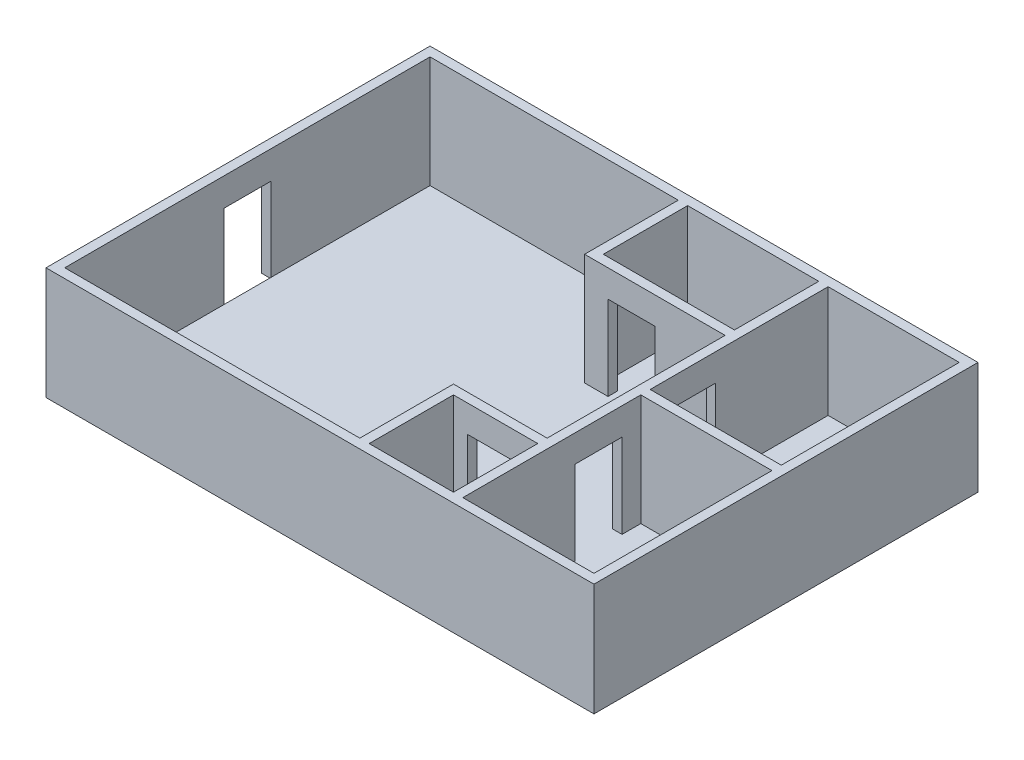
from build123d import *

# Parameters (mm, degrees)
EXTRUDE_THIN1_OUTLINE_W   = 1485.9
EXTRUDE_THIN1_OUTLINE_H   = 1041.4
EXTRUDE_THIN1_OUTLINE_W_2 = 228.6
EXTRUDE_THIN1_OUTLINE_H_2 = 228.6
EXTRUDE_THIN1_OUTLINE_W_3 = 355.6
EXTRUDE_THIN1_OUTLINE_H_3 = 482.6
EXTRUDE_THIN1_DEPTH       = 304.8
SKETCH1_5_W               = 1460.5
SKETCH1_5_H               = 1016
BOSS_EXTRUDE1_DEPTH       = 2.54
CUT_EXTRUDE1_DEPTH        = 25.4
SKETCH4_W                 = 127
SKETCH4_H                 = 228.6
CUT_EXTRUDE2_DEPTH        = 25.4
SKETCH5_W                 = 127
SKETCH5_H                 = 228.6
CUT_EXTRUDE3_DEPTH        = 25.4
SKETCH6_W                 = 127
SKETCH6_H                 = 228.6
CUT_EXTRUDE4_DEPTH        = 25.4


# Read off the part's stored shape, not the designer's step: Extrude-Thin1
with BuildPart() as part:
    # Extrude-Thin1 outline → Extrude-Thin1 (new body)
    with BuildSketch(Plane(origin=(0, 0, 0), x_dir=(1, 0, 0), z_dir=(0, 1, 0))):
        Rectangle(EXTRUDE_THIN1_OUTLINE_W, EXTRUDE_THIN1_OUTLINE_H)
        with Locations((222.25, -381)):
            Rectangle(EXTRUDE_THIN1_OUTLINE_W_2, EXTRUDE_THIN1_OUTLINE_H_2, mode=Mode.SUBTRACT)
        with Locations((539.75, -254)):
            Rectangle(EXTRUDE_THIN1_OUTLINE_W_3, EXTRUDE_THIN1_OUTLINE_H_3, mode=Mode.SUBTRACT)
        Polygon((-44.45, 495.3), (-44.45, 241.3), (336.55, 241.3), (336.55, -241.3), (82.55, -241.3), (82.55, -495.3), (-717.55, -495.3), (-717.55, 495.3), align=None, mode=Mode.SUBTRACT)
        with Locations((539.75, 254)):
            Rectangle(EXTRUDE_THIN1_OUTLINE_W_3, EXTRUDE_THIN1_OUTLINE_H_3, mode=Mode.SUBTRACT)
        with Locations((158.75, 381)):
            Rectangle(EXTRUDE_THIN1_OUTLINE_W_3, EXTRUDE_THIN1_OUTLINE_H_2, mode=Mode.SUBTRACT)
    extrude(amount=EXTRUDE_THIN1_DEPTH)

    # Sketch1<5> → Boss-Extrude1 (add)
    with BuildSketch(Plane(origin=(0, 0, 0), x_dir=(1, 0, 0), z_dir=(0, 1, 0))):
        Rectangle(SKETCH1_5_W, SKETCH1_5_H)
    extrude(amount=BOSS_EXTRUDE1_DEPTH)

    # Sketch2 → Cut-Extrude1 (cut)
    with BuildSketch(Plane.ZY.offset(742.95)):
        Polygon((-63.5, 0), (-63.5, 228.6), (63.5, 228.6), (63.5, 0), (0, 0), align=None)
    extrude(amount=-CUT_EXTRUDE1_DEPTH, mode=Mode.SUBTRACT)

    # Sketch4 → Cut-Extrude2 (cut)
    with BuildSketch(Plane.ZY.offset(-336.55)):
        with Locations((-127, 116.84)):
            Rectangle(SKETCH4_W, SKETCH4_H)
        with Locations((127, 116.84)):
            Rectangle(SKETCH4_W, SKETCH4_H)
    extrude(amount=-CUT_EXTRUDE2_DEPTH, mode=Mode.SUBTRACT)

    # Sketch5 → Cut-Extrude3 (cut)
    with BuildSketch(Plane(origin=(0, 0, 241.3), x_dir=(-1, 0, 0), z_dir=(0, 0, -1))):
        with Locations((-209.55, 116.84)):
            Rectangle(SKETCH5_W, SKETCH5_H)
    extrude(amount=-CUT_EXTRUDE3_DEPTH, mode=Mode.SUBTRACT)

    # Sketch6 → Cut-Extrude4 (cut)
    with BuildSketch(Plane.XY.offset(-241.3)):
        with Locations((82.55, 116.84)):
            Rectangle(SKETCH6_W, SKETCH6_H)
    extrude(amount=-CUT_EXTRUDE4_DEPTH, mode=Mode.SUBTRACT)


solid = part.part
